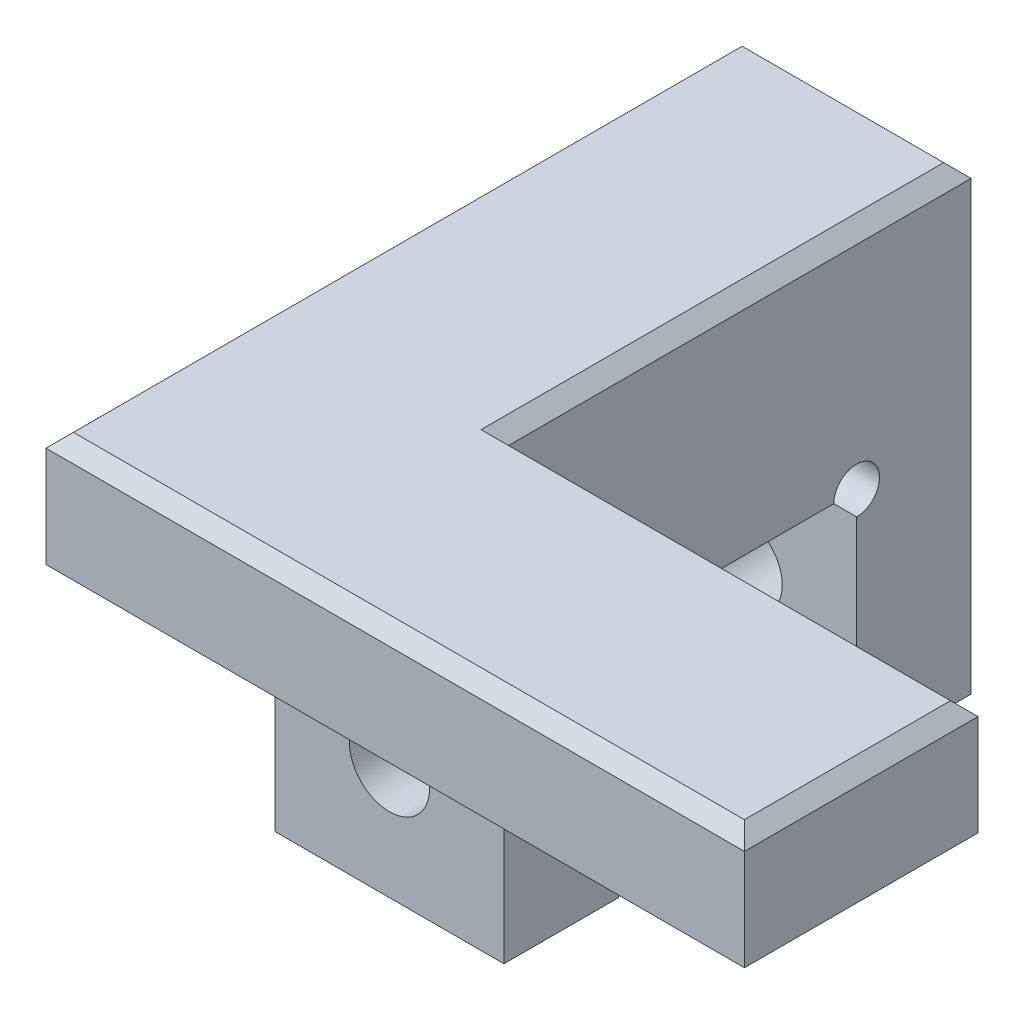
from build123d import *

# Parameters (mm, degrees)
EXTRUDE_1_DEPTH             = 10
SKETCH_2_R                  = 1.75
CUT_EXTRUDE_1_DEPTH         = 25.822570375
EXTRUDE_2_DEPTH             = 5
SKETCH_4_R                  = 3.2
CUT_EXTRUDE_2_DEPTH         = 2.6
SKETCH_5_R                  = 1
CUT_EXTRUDE_3_DEPTH         = 33.45442959
CHAMFER_1_SIZE              = 0.6
CHAMFER_1_OF_MIRROR_10_SIZE = 0.6
SKETCH_6_W                  = 45.235860223
SKETCH_6_H                  = 37.715306306
CUT_EXTRUDE_4_DEPTH         = 50.520702741


with BuildPart() as part:
    # ｽｹｯﾁ1 → ﾎﾞｽ - 押し出し1 (new body)
    with BuildSketch(Plane(origin=(0, 0, 0), x_dir=(0, 0, -1), z_dir=(1, 0, 0))):
        Polygon((5.2, 5.1), (5.2, -5.1), (10.2, -5.1), (10.2, 10), (-10.2, 10), (-10.2, -5.1), (-5.2, -5.1), (-5.2, 5.1), align=None)
    extrude_1 = extrude(amount=EXTRUDE_1_DEPTH)

    # ｽｹｯﾁ2 → ｶｯﾄ - 押し出し1 (cut, symmetric)
    with BuildSketch(Plane.XY.offset(10.2)):
        with Locations((5, -0.1)):
            Circle(SKETCH_2_R)
    cut_extrude_1 = extrude(amount=CUT_EXTRUDE_1_DEPTH, both=True, mode=Mode.SUBTRACT)

    # ｽｹｯﾁ3 → ﾎﾞｽ - 押し出し2 (add)
    with BuildSketch(Plane(origin=(0, 10, 0), x_dir=(1, 0, 0), z_dir=(0, 1, 0))):
        Polygon((10, -10.2), (10, -20.2), (-20.5, -20.2), (-20.5, -10), (0, -10), (0, 10.2), (10, 10.2), align=None)
    extrude_2 = extrude(amount=EXTRUDE_2_DEPTH)

    # ｽｹｯﾁ4 → ｶｯﾄ - 押し出し2 (cut)
    with BuildSketch(Plane.XZ.offset(-10)):
        with Locations((-10.25, 15.1)):
            Circle(SKETCH_4_R)
    cut_extrude_2 = extrude(amount=-CUT_EXTRUDE_2_DEPTH, mode=Mode.SUBTRACT)

    # ｽｹｯﾁ5 → ｶｯﾄ - 押し出し3 (cut, through all)
    with BuildSketch(Plane.ZY):
        with Locations((5.2, 5.1)):
            Circle(SKETCH_5_R)
        with Locations((-5.2, 5.1)):
            Circle(SKETCH_5_R)
    cut_extrude_3 = extrude(amount=-CUT_EXTRUDE_3_DEPTH, mode=Mode.SUBTRACT)

    # 面取り1
    chamfer_1_edges = [part.edges().sort_by_distance(p)[0] for p in [
        (-20.5, 15, 15.1),
        (-10.25, 15, 10),
        (0, 15, -0.1),
        (5, 15, -10.2),
        (10, 15, 5),
        (-5.25, 15, 20.2),
    ]]
    chamfer(chamfer_1_edges, length=CHAMFER_1_SIZE)


with BuildPart() as mirror_10_1:
    # ﾐﾗｰ10: ﾎﾞｽ - 押し出し1 across plane
    add(extrude_1.mirror(Plane(origin=(10, 0, 0), x_dir=(0, 0, 1), z_dir=(1, 0, 0))))

    # Mirror 10 2: ｶｯﾄ - 押し出し1 across plane
    add(cut_extrude_1.mirror(Plane(origin=(10, 0, 0), x_dir=(0, 0, 1), z_dir=(1, 0, 0))), mode=Mode.SUBTRACT)


with BuildPart() as mirror_10_3_1:
    # Mirror 10 3: ﾎﾞｽ - 押し出し2 across plane
    add(extrude_2.mirror(Plane(origin=(10, 0, 0), x_dir=(0, 0, 1), z_dir=(1, 0, 0))))


with BuildPart() as mirror_10_4_tool:
    # Mirror 10 4: ｶｯﾄ - 押し出し2, ｶｯﾄ - 押し出し3 across plane
    add(cut_extrude_2.mirror(Plane(origin=(10, 0, 0), x_dir=(0, 0, 1), z_dir=(1, 0, 0))))
    add(cut_extrude_3.mirror(Plane(origin=(10, 0, 0), x_dir=(0, 0, 1), z_dir=(1, 0, 0))))


with BuildPart() as mirror_10_1_1:
    add(mirror_10_1.part)

    # Mirror 10 4: cut by mirror_10_4_tool
    add(mirror_10_4_tool.part, mode=Mode.SUBTRACT)


with BuildPart() as mirror_10_3_1_1:
    add(mirror_10_3_1.part)

    # Mirror 10 4: cut by mirror_10_4_tool
    add(mirror_10_4_tool.part, mode=Mode.SUBTRACT)

    # 面取り1 of ﾐﾗｰ10
    chamfer_1_of_mirror_10_edges = [mirror_10_3_1_1.edges().sort_by_distance(p)[0] for p in [
        (40.5, 15, 15.1),
        (30.25, 15, 10),
        (20, 15, -0.1),
        (15, 15, -10.2),
        (10, 15, 5),
        (25.25, 15, 20.2),
    ]]
    chamfer(chamfer_1_of_mirror_10_edges, length=CHAMFER_1_OF_MIRROR_10_SIZE)


with BuildPart() as part_1:
    add(part.part)

    # ﾐﾗｰ10 united with what the copies to: union ﾐﾗｰ10_1, ﾐﾗｰ10 3_1
    add(mirror_10_1_1.part)
    add(mirror_10_3_1_1.part)

    # ｽｹｯﾁ6 → ｶｯﾄ - 押し出し4 (cut, through all)
    with BuildSketch(Plane(origin=(0, 15, 0), x_dir=(1, 0, 0), z_dir=(0, 1, 0))):
        with Locations((-12.617930112, -1.342346847)):
            Rectangle(SKETCH_6_W, SKETCH_6_H)
    extrude(amount=-CUT_EXTRUDE_4_DEPTH, mode=Mode.SUBTRACT)


solid = part_1.part
